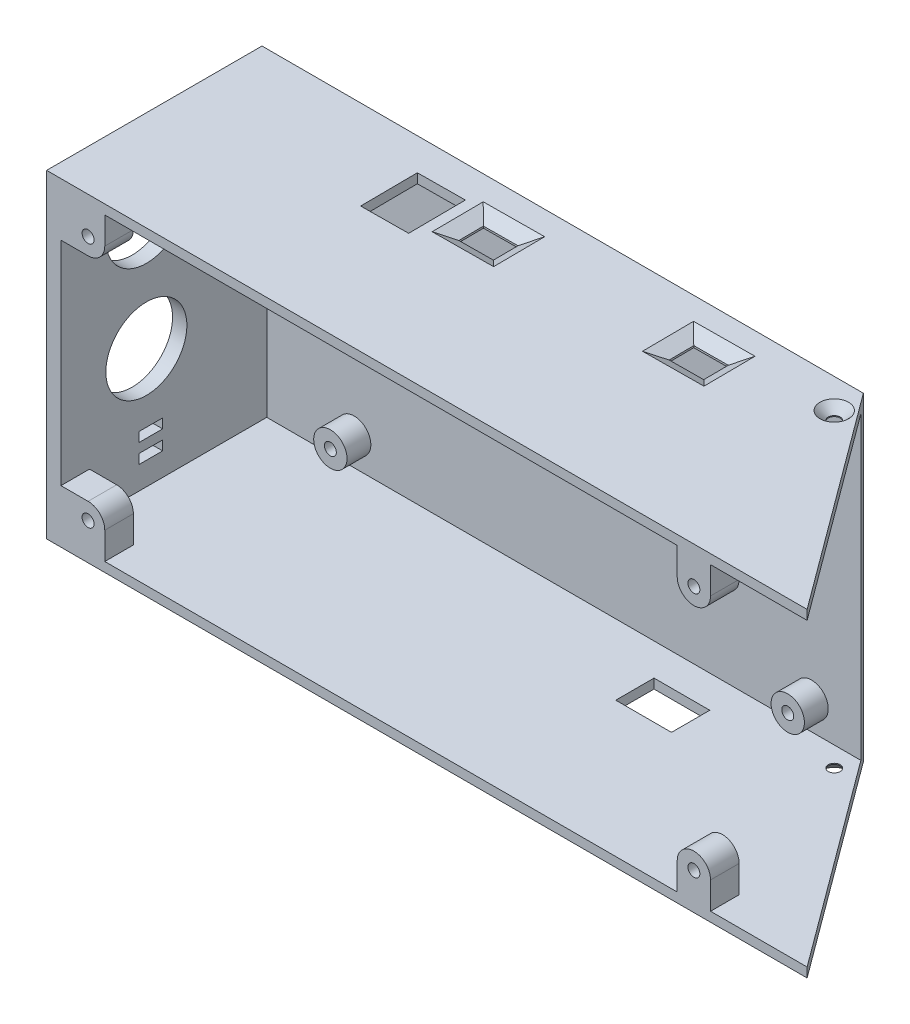
from build123d import *

# Parameters (mm, degrees)
SZKIC1_W                        = 157.665871289
SZKIC1_H                        = 63
DODANIE_WYCI_GNI_CIE1_DEPTH     = 43.2
WYTNIJ_WYCI_GNI_CIE1_DEPTH      = 70
SKORUPA3_START                  = -70.275069684
SKORUPA3_OUTLINE_W              = 67
SKORUPA3_OUTLINE_H              = 48.2
SKORUPA3_DEPTH                  = 3
SKORUPA3_START_2                = -127.5
SKORUPA3_2_DEPTH                = 63
SKORUPA3_START_3                = -129.5
SKORUPA3_3_DEPTH                = 67
SKORUPA3_4_DEPTH                = 2
SKORUPA3_START_4                = -64.5
SKORUPA3_5_DEPTH                = 2
WYTNIJ_WYCI_GNI_CIE3_DEPTH      = 125.94228845
WYTNIJ_WYCI_GNI_CIE3_DEPTH_BACK = 125.94228845
SZKIC8_W                        = 222.336022924
SZKIC8_H                        = 159.302089512
WYTNIJ_WYCI_GNI_CIE5_DEPTH      = 10
GNIAZDO1_START                  = -65
GNIAZDO1_OUTLINE_R              = 1.25
GNIAZDO1_DEPTH                  = 3
GNIAZDO3_START                  = -130
GNIAZDO3_OUTLINE_R              = 1.25
GNIAZDO3_DEPTH                  = 3
SZKIC12_W                       = 5
SZKIC12_H                       = 2
WYTNIJ_WYCI_GNI_CIE6_DEPTH      = 6
SZKIC14_R                       = 8.5
WYTNIJ_WYCI_GNI_CIE7_DEPTH      = 6
SZKIC15_R                       = 1.254921328
SZKIC15_R_2                     = 1.25
DODANIE_WYCI_GNI_CIE3_DEPTH     = 6
WYTNIJ_WYCI_GNI_CIE8_DEPTH      = 6
SFAZOWANIE1_SIZE                = 2.8
SFAZOWANIE1_SIZE2               = 1.616580754
SFAZOWANIE2_SIZE                = 2.8
SFAZOWANIE2_SIZE2               = 1.616580754
SZKIC18_W                       = 11.697755772
SZKIC18_H                       = 8.037601452
WYTNIJ_WYCI_GNI_CIE9_DEPTH      = 6
SZKIC19_R                       = 3.5
SZKIC19_R_2                     = 1.25
DODANIE_WYCI_GNI_CIE4_DEPTH     = 5


with BuildPart() as part:
    # Szkic1 → Dodanie-wyciągnięcie1 (new body)
    with BuildSketch(Plane.XY):
        with Locations((11.557865961, -96)):
            Rectangle(SZKIC1_W, SZKIC1_H)
    extrude(amount=-DODANIE_WYCI_GNI_CIE1_DEPTH)

    # Szkic2 → Wytnij-wyciągnięcie1 (cut)
    with BuildSketch(Plane.XZ.offset(127.5)):
        Polygon((91.579553956, 3.037978518), (97.149949113, -5.556810967), (99.754808073, -53.374579011), (51.257151272, -51.543792256), align=None)
    extrude(amount=-WYTNIJ_WYCI_GNI_CIE1_DEPTH, mode=Mode.SUBTRACT)

    # Skorupa3: read off the stored shape, not the designer's step
    # Skorupa3 outline → Skorupa3 (add)
    with BuildSketch(Plane.YZ.offset(SKORUPA3_START)):
        with Locations((-96, -21.1)):
            Rectangle(SKORUPA3_OUTLINE_W, SKORUPA3_OUTLINE_H)
    extrude(amount=SKORUPA3_DEPTH)

    # Skorupa3 2 outline → Skorupa3 2 (cut)
    with BuildSketch(Plane(origin=(0, 0, 0), x_dir=(1, 0, 0), z_dir=(0, 1, 0)).offset(SKORUPA3_START_2)):
        Polygon((57.421146073, 43.2), (-67.275069684, 43.2), (-67.275069684, 0), (89.335240673, 0), align=None)
    extrude(amount=SKORUPA3_2_DEPTH, mode=Mode.SUBTRACT)

    # Skorupa3 3 outline → Skorupa3 3 (add)
    with BuildSketch(Plane(origin=(0, 0, 0), x_dir=(1, 0, 0), z_dir=(0, 1, 0)).offset(SKORUPA3_START_3)):
        Polygon((95.281348873, -3), (59.673493323, 45.2), (-67.275069684, 45.2), (-67.275069684, 43.2), (57.421146073, 43.2), (89.335240673, 0), (-67.275069684, 0), (-67.275069684, -3), align=None)
    extrude(amount=SKORUPA3_3_DEPTH)

    # Skorupa3 4 outline → Skorupa3 4 (add)
    with BuildSketch(Plane(origin=(0, 0, 0), x_dir=(1, 0, 0), z_dir=(0, 1, 0)).offset(SKORUPA3_START_3)):
        Polygon((57.421146073, 43.2), (-67.275069684, 43.2), (-67.275069684, 0), (89.335240673, 0), align=None)
    extrude(amount=SKORUPA3_4_DEPTH)

    # Skorupa3 5 outline → Skorupa3 5 (add)
    with BuildSketch(Plane(origin=(0, 0, 0), x_dir=(1, 0, 0), z_dir=(0, 1, 0)).offset(SKORUPA3_START_4)):
        Polygon((57.421146073, 43.2), (-67.275069684, 43.2), (-67.275069684, 0), (89.335240673, 0), align=None)
    extrude(amount=SKORUPA3_5_DEPTH)

    # Szkic6 → Wytnij-wyciągnięcie3 (cut, two sides: drawn at the far end of the back side and taken through both)
    with BuildSketch(Plane.XZ.offset(129.5).offset(-WYTNIJ_WYCI_GNI_CIE3_DEPTH_BACK)):
        Polygon((-150.660373393, -324.866196497), (55.943641693, -45.2), (91.551497243, 3), (298.155512329, 282.666196497), (857.487905323, -130.541833674), (408.672019601, -738.074226668), align=None)
    extrude(amount=WYTNIJ_WYCI_GNI_CIE3_DEPTH + WYTNIJ_WYCI_GNI_CIE3_DEPTH_BACK, mode=Mode.SUBTRACT)


with BuildPart() as body_2:
    # Podziel3: the piece on the far side of the plane
    add(part.part)
    split(bisect_by=Plane(origin=(0, 0, 0), x_dir=(-1, 0, 0), z_dir=(0, 0, -1)), keep=Keep.BOTTOM)

    # Szkic8 → Wytnij-wyciągnięcie5 (cut)
    with BuildSketch(Plane(origin=(0, 0, 0), x_dir=(-1, 0, 0), z_dir=(0, 0, -1))):
        with Locations((-14.849623727, -113.028264145)):
            Rectangle(SZKIC8_W, SZKIC8_H)
    extrude(amount=-WYTNIJ_WYCI_GNI_CIE5_DEPTH, mode=Mode.SUBTRACT)


with BuildPart() as part_1:
    add(part.part)

    # Podziel3
    split(bisect_by=Plane(origin=(0, 0, 0), x_dir=(-1, 0, 0), z_dir=(0, 0, -1)), keep=Keep.TOP)

    # Gniazdo1: read off the stored shape, not the designer's step
    # Gniazdo1 outline → Gniazdo1 (cut)
    with BuildSketch(Plane(origin=(0, 0, 0), x_dir=(1, 0, 0), z_dir=(0, 1, 0)).offset(GNIAZDO1_START)):
        with Locations((56.030137684, 39)):
            Circle(GNIAZDO1_OUTLINE_R)
    extrude(amount=GNIAZDO1_DEPTH, mode=Mode.SUBTRACT)

    # Gniazdo1 2: loft between two sections, ruled curve by curve
    gniazdo1_2_from = [
        Edge.make_bspline([(57.178770241, -64.3, -39.493095579), (56.192579083, -64.3, -41.790360692), (53.89531397, -64.3, -40.804169534), (54.881505128, -64.3, -38.506904421), (55.867696286, -64.3, -36.209639308), (58.164961399, -64.3, -37.195830466), (57.178770241, -64.3, -39.493095579)], [0, 0, 0, 0, 0.5, 0.5, 0.5, 1, 1, 1, 1], 3, [1, 0.333333333, 0.333333333, 1, 0.333333333, 0.333333333, 1]),
    ]
    gniazdo1_2_to = [
        Edge.make_bspline([(58.38973631, -62.5, -40.852645223), (54.684445863, -62.5, -45.571842476), (49.965248611, -62.5, -41.866552029), (53.670539058, -62.5, -37.147354777), (57.375829505, -62.5, -32.428157524), (62.095026757, -62.5, -36.133447971), (58.38973631, -62.5, -40.852645223)], [0, 0, 0, 0, 0.5, 0.5, 0.5, 1, 1, 1, 1], 3, [1, 0.333333333, 0.333333333, 1, 0.333333333, 0.333333333, 1]),
    ]
    gniazdo1_2 = Solid(Shell([*[Face.make_surface_from_curves(gniazdo1_2_from[k], gniazdo1_2_to[k]) for k in range(1)], Face(Wire(gniazdo1_2_from)), Face(Wire(gniazdo1_2_to))]))
    add(gniazdo1_2, mode=Mode.SUBTRACT)

    # Gniazdo3: read off the stored shape, not the designer's step
    # Gniazdo3 outline → Gniazdo3 (cut)
    with BuildSketch(Plane(origin=(0, 0, 0), x_dir=(1, 0, 0), z_dir=(0, 1, 0)).offset(GNIAZDO3_START)):
        with Locations((56.030137684, 39)):
            Circle(GNIAZDO3_OUTLINE_R)
    extrude(amount=GNIAZDO3_DEPTH, mode=Mode.SUBTRACT)

    # Gniazdo3 2: loft between two sections, ruled curve by curve
    gniazdo3_2_from = [
        Edge.make_bspline([(55.157993378, -127.7, -39.895468765), (56.948930908, -127.7, -41.639757378), (58.69321952, -127.7, -39.848819848), (56.90228199, -127.7, -38.104531235), (55.111344461, -127.7, -36.360242622), (53.367055848, -127.7, -38.151180152), (55.157993378, -127.7, -39.895468765)], [0, 0, 0, 0, 0.5, 0.5, 0.5, 1, 1, 1, 1], 3, [1, 0.333333333, 0.333333333, 1, 0.333333333, 0.333333333, 1]),
    ]
    gniazdo3_2_to = [
        Edge.make_bspline([(54.560164229, -129.5, -41.61518222), (59.790528668, -129.5, -44.555129129), (62.730475578, -129.5, -39.32476469), (57.500111139, -129.5, -36.38481778), (52.2697467, -129.5, -33.444870871), (49.32979979, -129.5, -38.67523531), (54.560164229, -129.5, -41.61518222)], [0, 0, 0, 0, 0.5, 0.5, 0.5, 1, 1, 1, 1], 3, [1, 0.333333333, 0.333333333, 1, 0.333333333, 0.333333333, 1]),
    ]
    gniazdo3_2 = Solid(Shell([*[Face.make_surface_from_curves(gniazdo3_2_from[k], gniazdo3_2_to[k]) for k in range(1)], Face(Wire(gniazdo3_2_from)), Face(Wire(gniazdo3_2_to))]))
    add(gniazdo3_2, mode=Mode.SUBTRACT)

    # Szkic12 → Wytnij-wyciągnięcie6 (cut)
    with BuildSketch(Plane.ZY.offset(70.275069684)):
        with Locations((-18.844920008, -121.667032498)):
            Rectangle(SZKIC12_W, SZKIC12_H)
        with Locations((-18.844920008, -117.667032498)):
            Rectangle(SZKIC12_W, SZKIC12_H)
    extrude(amount=-WYTNIJ_WYCI_GNI_CIE6_DEPTH, mode=Mode.SUBTRACT)

    # Szkic14 → Wytnij-wyciągnięcie7 (cut)
    with BuildSketch(Plane.ZY.offset(70.275069684)):
        with Locations((-17.931460918, -102.383556509)):
            Circle(SZKIC14_R)
        with Locations((-17.931460918, -78.383556509)):
            Circle(SZKIC14_R)
    extrude(amount=-WYTNIJ_WYCI_GNI_CIE7_DEPTH, mode=Mode.SUBTRACT)

    # Szkic15 → Dodanie-wyciągnięcie3 (add)
    # profile 1 of 4: a face of its own
    with BuildSketch(Plane.XY):
        with BuildLine():
            Line((-67.275069684, -64.5), (-58.075069684, -64.5))
            Line((-58.075069684, -64.5), (-58.075069684, -70.186449015))
            ThreePointArc((-58.075069684, -70.186449015), (-59.101217036, -72.66378787), (-61.578555891, -73.689935222))
            Line((-61.578555891, -73.689935222), (-67.275069684, -73.689935222))
            Line((-67.275069684, -73.689935222), (-67.275069684, -64.5))
        make_face()
        with Locations((-61.578555891, -70.186449015)):
            Circle(SZKIC15_R, mode=Mode.SUBTRACT)
    # profile 2 of 4: a face of its own
    with BuildSketch(Plane.XY):
        with BuildLine():
            Line((-61.578555891, -118.310064778), (-67.275069684, -118.310064778))
            Line((-67.275069684, -118.310064778), (-67.275069684, -127.5))
            Line((-67.275069684, -127.5), (-58.075069684, -127.5))
            Line((-58.075069684, -127.5), (-58.075069684, -121.813550985))
            ThreePointArc((-58.075069684, -121.813550985), (-59.101217036, -119.33621213), (-61.578555891, -118.310064778))
        make_face()
        with Locations(Location((-61.578555891, -121.813550985, 0), (0, 0, 180))):
            Circle(SZKIC15_R, mode=Mode.SUBTRACT)
    # profile 3 of 4: a face of its own
    with BuildSketch(Plane.XY):
        with BuildLine():
            Line((62.071003797, -64.5), (69.071003797, -64.5))
            Line((69.071003797, -64.5), (69.071003797, -70.189935222))
            ThreePointArc((69.071003797, -70.189935222), (65.571003797, -73.689935222), (62.071003797, -70.189935222))
            Line((62.071003797, -70.189935222), (62.071003797, -64.5))
        make_face()
        with Locations(Location((65.571003797, -70.189935222, 0), (0, 0, 180))):
            Circle(SZKIC15_R_2, mode=Mode.SUBTRACT)
    # profile 4 of 4: a face of its own
    with BuildSketch(Plane.XY):
        with BuildLine():
            Line((62.071003797, -121.810064778), (62.071003797, -127.5))
            Line((62.071003797, -127.5), (69.071003797, -127.5))
            Line((69.071003797, -127.5), (69.071003797, -121.810064778))
            ThreePointArc((69.071003797, -121.810064778), (65.571003797, -118.310064778), (62.071003797, -121.810064778))
        make_face()
        with Locations((65.571003797, -121.810064778)):
            Circle(SZKIC15_R_2, mode=Mode.SUBTRACT)
    extrude(amount=-DODANIE_WYCI_GNI_CIE3_DEPTH)

    # Szkic16 → Wytnij-wyciągnięcie8 (cut)
    with BuildSketch(Plane(origin=(0, -62.5, 0), x_dir=(1, 0, 0), z_dir=(0, 1, 0))):
        Polygon((-30.93039737, 38.46371172), (-30.835059061, 26.464090451), (-20.83537467, 26.543539042), (-20.930712979, 38.543160311), align=None)
        Polygon((-15.920840254, 37.320228125), (-15.879526987, 32.120392242), (-8.679754225, 32.177595227), (-8.721067492, 37.377431111), align=None)
        Polygon((35.118865476, 32.525583902), (35.077552208, 37.725419785), (27.877779447, 37.6682168), (27.919092714, 32.468380916), align=None)
    extrude(amount=-WYTNIJ_WYCI_GNI_CIE8_DEPTH, mode=Mode.SUBTRACT)

    # Sfazowanie1
    sfazowanie1_edges = [part_1.edges().sort_by_distance(p)[0] for p in [
        (-12.320953873, -62.5, -37.348829618),
        (-15.90018362, -62.5, -34.720310183),
        (-12.279640606, -62.5, -32.148993734),
        (-8.700410859, -62.5, -34.777513169),
    ]]
    sfazowanie1_side = [part_1.faces().sort_by_distance(p)[0] for p in [
        (1.68835408, -62.5, -21.274952825),
    ]]
    chamfer(sfazowanie1_edges, length=SFAZOWANIE1_SIZE, length2=SFAZOWANIE1_SIZE2, reference=sfazowanie1_side[0])

    # Sfazowanie2
    sfazowanie2_edges = [part_1.edges().sort_by_distance(p)[0] for p in [
        (31.518979095, -62.5, -32.496982409),
        (35.098208842, -62.5, -35.125501843),
        (31.477665827, -62.5, -37.696818292),
        (27.89843608, -62.5, -35.068298858),
    ]]
    sfazowanie2_side = [part_1.faces().sort_by_distance(p)[0] for p in [
        (1.918169966, -62.5, -21.053592687),
    ]]
    chamfer(sfazowanie2_edges, length=SFAZOWANIE2_SIZE, length2=SFAZOWANIE2_SIZE2, reference=sfazowanie2_side[0])

    # Szkic18 → Wytnij-wyciągnięcie9 (cut)
    with BuildSketch(Plane.XZ.offset(129.5)):
        with Locations((26.605394486, -32.432863354)):
            Rectangle(SZKIC18_W, SZKIC18_H)
    extrude(amount=-WYTNIJ_WYCI_GNI_CIE9_DEPTH, mode=Mode.SUBTRACT)

    # Szkic19 → Dodanie-wyciągnięcie4 (add)
    # profile 1 of 4: a face of its own
    with BuildSketch(Plane.XY.offset(-43.2)):
        with Locations(Location((-48.925840705, -69.572737381, 0), (0, 0, 180))):
            Circle(SZKIC19_R)
        with Locations((-48.925840705, -69.572737381)):
            Circle(SZKIC19_R_2, mode=Mode.SUBTRACT)
    # profile 2 of 4: a face of its own
    with BuildSketch(Plane.XY.offset(-43.2)):
        with Locations(Location((-48.925840705, -121.572737521, 0), (0, 0, 180))):
            Circle(SZKIC19_R)
        with Locations((-48.925840705, -121.572737521)):
            Circle(SZKIC19_R_2, mode=Mode.SUBTRACT)
    # profile 3 of 4: a face of its own
    with BuildSketch(Plane.XY.offset(-43.2)):
        with Locations(Location((47.071130423, -79.822737201, 0), (0, 0, 180))):
            Circle(SZKIC19_R)
        with Locations((47.071130423, -79.822737201)):
            Circle(SZKIC19_R_2, mode=Mode.SUBTRACT)
    # profile 4 of 4: a face of its own
    with BuildSketch(Plane.XY.offset(-43.2)):
        with Locations(Location((47.071130423, -121.572737521, 0), (0, 0, 180))):
            Circle(SZKIC19_R)
        with Locations((47.071130423, -121.572737521)):
            Circle(SZKIC19_R_2, mode=Mode.SUBTRACT)
    extrude(amount=DODANIE_WYCI_GNI_CIE4_DEPTH)


solid = part_1.part
